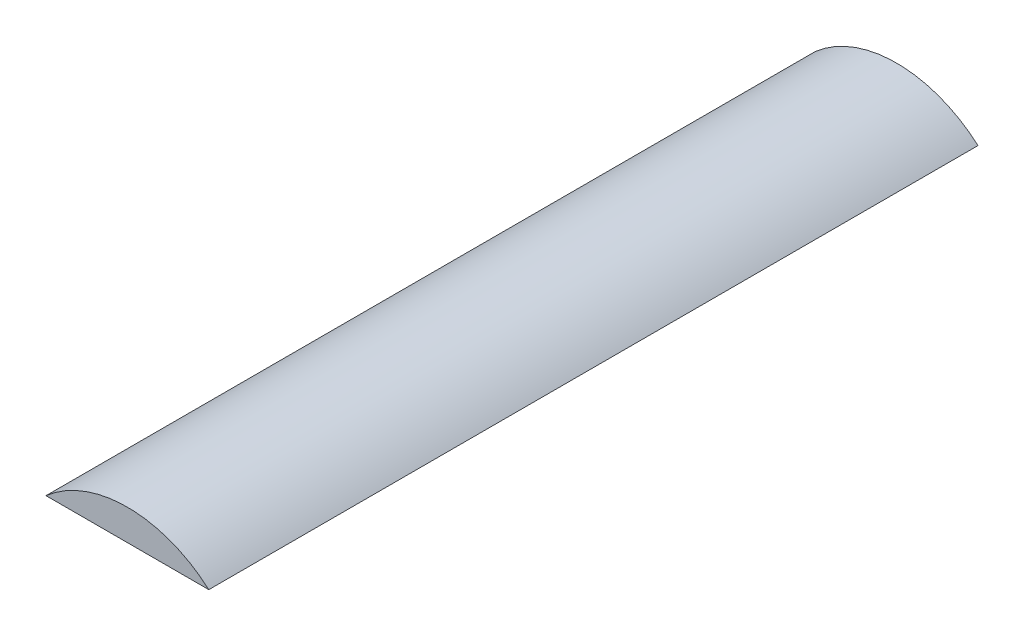
from build123d import *

# Parameters (mm, degrees)
EXTRUDE_1_DEPTH = 100


with BuildPart() as part:
    # 草图1 → 凸台-拉伸1 (new body)
    with BuildSketch(Plane.XY):
        with BuildLine():
            Line((5, 1), (-5.583005244, 1))
            ThreePointArc((-5.583005244, 1), (5, 5), (15.583005244, 1))
            Line((15.583005244, 1), (5, 1))
        make_face()
    extrude(amount=EXTRUDE_1_DEPTH)


solid = part.part
